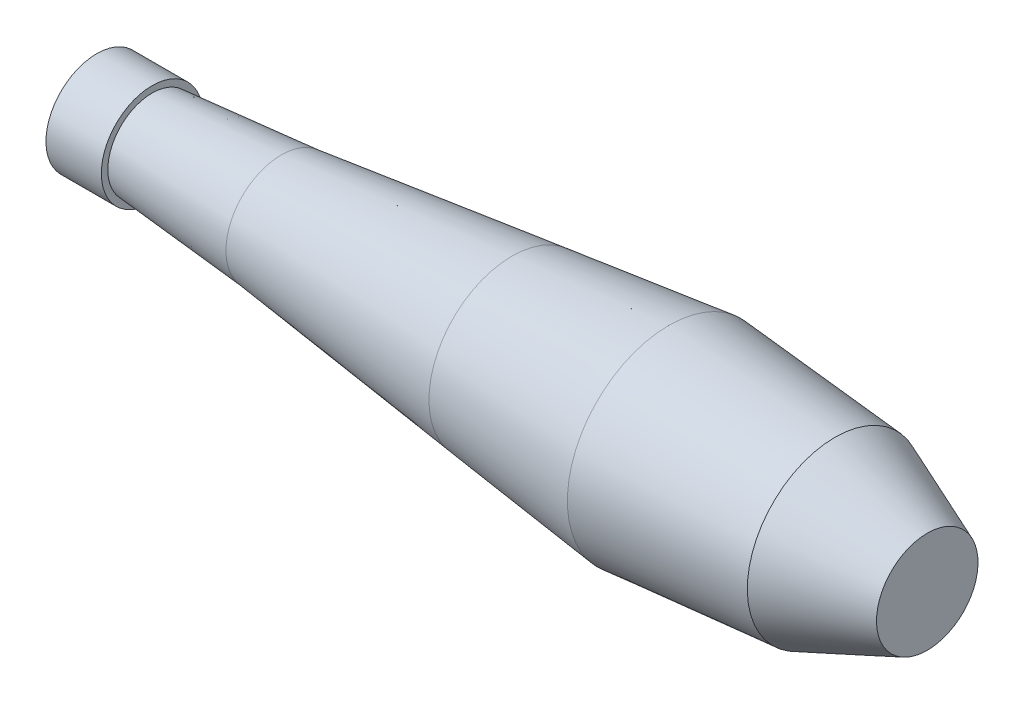
from build123d import *

# Parameters (mm, degrees)
REVOLVE1_ANGLE = 359.999695921


with BuildPart() as part:
    # Sketch1 → Revolve1 (revolve)
    with BuildSketch(Plane.XY):
        Polygon((0, 0), (0, 5.5), (6, 5.5), (6, 4.8), (20, 6), (45, 9), (62, 11), (80, 9.5), (90, 5.5), (90, 0), align=None)
    revolve(axis=Axis((0, 0, 0), (1, 0, 0)), revolution_arc=REVOLVE1_ANGLE)


solid = part.part
